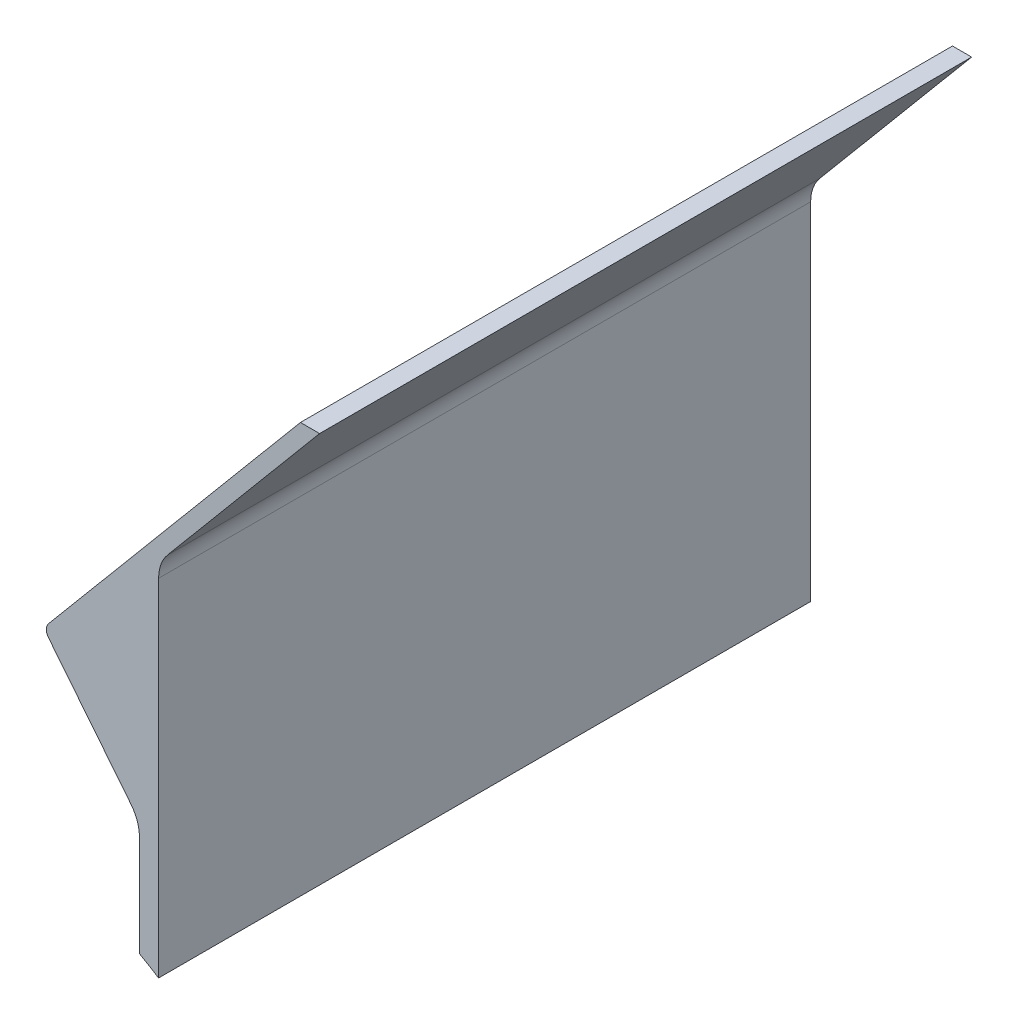
from build123d import *

# Parameters (mm, degrees)
FUNNEL_RIGHT_SIDE_DEPTH = 170
FILLET2_R               = 10
FILLET3_R               = 2.5


with BuildPart() as part:
    # Sketch1 → Funnel - Right Side (new body)
    with BuildSketch(Plane.XY):
        with BuildLine():
            Line((0, 0), (0, 93.9))
            Line((0, 93.9), (41.974030913, 143.922702136))
            Line((41.974030913, 143.922702136), (36.974030913, 143.922702136))
            Line((36.974030913, 143.922702136), (-30, 64.106160185))
            Line((-30, 64.106160185), (-5, 32.881170193))
            Line((-5, 32.881170193), (-5, 3.009647488))
            ThreePointArc((-5, 3.009647488), (-2.486276932, 1.527622208), (0, 0))
        make_face()
    extrude(amount=FUNNEL_RIGHT_SIDE_DEPTH)

    # Fillet2
    fillet2_edges = [part.edges().sort_by_distance(p)[0] for p in [
        (0, 93.9, 85),
        (-5, 32.881170193, 85),
    ]]
    fillet(fillet2_edges, radius=FILLET2_R)

    # Fillet3
    fillet3_edges = [part.edges().sort_by_distance(p)[0] for p in [
        (-30, 64.106160185, 85),
    ]]
    fillet(fillet3_edges, radius=FILLET3_R)


solid = part.part
